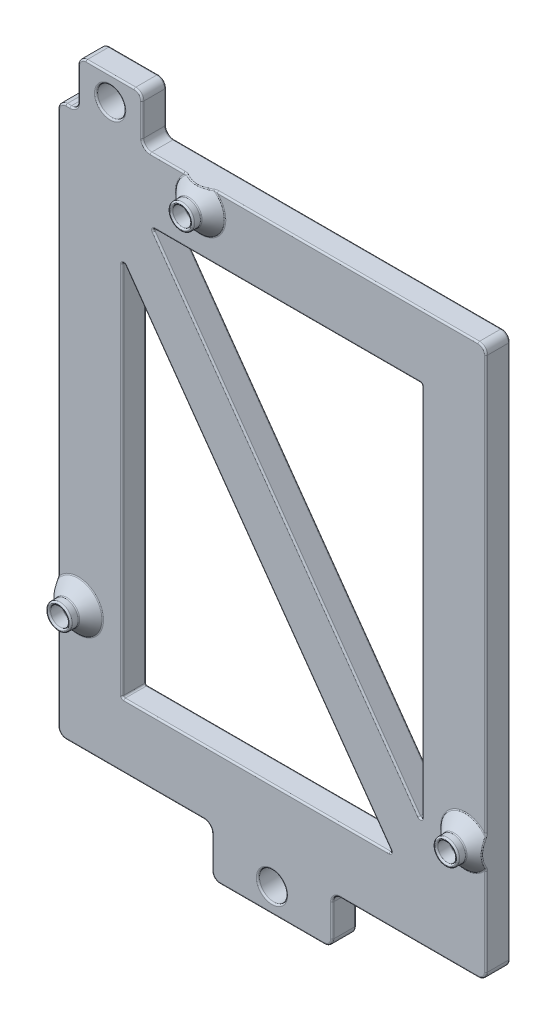
from build123d import *

# Parameters (mm, degrees)
SKIZZE1_R                       = 1.75
SKIZZE1_R_2                     = 1.15
AUFSATZ_LINEAR_AUSTRAGEN1_DEPTH = 3
VERRUNDUNG2_R                   = 1
SKIZZE4_R                       = 1.55
SKIZZE4_R_2                     = 1.15
AUFSATZ_LINEAR_AUSTRAGEN3_DEPTH = 2.5
FASE2_SIZE                      = 1.5
SKIZZE6_R                       = 1.85
SCHNITT_LINEAR_AUSTRAGEN3_DEPTH = 3.7
VERRUNDUNG4_R                   = 0.2


# Some blends are built 0.0001 mm under size
with BuildPart() as part:
    # Skizze1 → Aufsatz-Linear austragen1 (new body)
    with BuildSketch(Plane.XY):
        Polygon((0, 0), (19.17, 0), (19.17, -6), (34.17, -6), (34.17, 0), (53.34, 0), (53.34, 68.58), (10.5, 68.58), (10.5, 74.58), (2.5, 74.58), (2.5, 68.58), (0, 68.58), align=None)
        with Locations((6.5, 71.58)):
            Circle(SKIZZE1_R, mode=Mode.SUBTRACT)
        with Locations((26.67, -3)):
            Circle(SKIZZE1_R, mode=Mode.SUBTRACT)
        with Locations((2.54, 15.24)):
            Circle(SKIZZE1_R_2, mode=Mode.SUBTRACT)
        with Locations((50.8, 13.97)):
            Circle(SKIZZE1_R_2, mode=Mode.SUBTRACT)
        with Locations((17.78, 66.04)):
            Circle(SKIZZE1_R_2, mode=Mode.SUBTRACT)
        Polygon((8, 55.398710594), (41.660476485, 8), (8, 8), align=None, mode=Mode.SUBTRACT)
        Polygon((45.34, 13.181289406), (45.34, 60.58), (11.679523515, 60.58), align=None, mode=Mode.SUBTRACT)
    extrude(amount=AUFSATZ_LINEAR_AUSTRAGEN1_DEPTH)

    # Verrundung2
    verrundung2_edges = [part.edges().sort_by_distance(p)[0] for p in [
        (0, 68.58, 1.5),
        (2.5, 68.58, 1.5),
        (2.5, 74.58, 1.5),
        (10.5, 74.58, 1.5),
        (10.5, 68.58, 1.5),
        (53.34, 68.58, 1.5),
        (53.34, 0, 1.5),
        (34.17, 0, 1.5),
        (34.17, -6, 1.5),
        (19.17, -6, 1.5),
        (19.17, 0, 1.5),
        (0, 0, 1.5),
    ]]
    fillet(verrundung2_edges, radius=VERRUNDUNG2_R)

    # Skizze4 → Aufsatz-Linear austragen3 (add)
    # profile 1 of 3: a face of its own
    with BuildSketch(Plane.XY.offset(3)):
        with Locations(Location((2.54, 15.24, 0), (0, 0, 180))):
            Circle(SKIZZE4_R)
        with Locations((2.54, 15.24)):
            Circle(SKIZZE4_R_2, mode=Mode.SUBTRACT)
    # profile 2 of 3: a face of its own
    with BuildSketch(Plane.XY.offset(3)):
        with Locations(Location((50.8, 13.97, 0), (0, 0, 180))):
            Circle(SKIZZE4_R)
        with Locations((50.8, 13.97)):
            Circle(SKIZZE4_R_2, mode=Mode.SUBTRACT)
    # profile 3 of 3: a face of its own
    with BuildSketch(Plane.XY.offset(3)):
        with Locations(Location((17.78, 66.04, 0), (0, 0, 180))):
            Circle(SKIZZE4_R)
        with Locations((17.78, 66.04)):
            Circle(SKIZZE4_R_2, mode=Mode.SUBTRACT)
    extrude(amount=AUFSATZ_LINEAR_AUSTRAGEN3_DEPTH)

    # Fase2
    # the kernel refuses this chamfer: 1.5 mm, written as the material it adds along each edge
    with BuildSketch(Plane(origin=(17.78, 66.04, 3), x_dir=(-1, 0, 0), z_dir=(0, 1, 0))) as fase2_piece_1_section:
        Polygon((1.55 + FASE2_SIZE, 0), (1.55, FASE2_SIZE), (1.55, 0), align=None)
    fase2_piece_1 = revolve(axis=Axis((17.78, 66.04, 3), (0, 0, 1)), mode=Mode.PRIVATE)
    fase2_piece_1 = split(fase2_piece_1, bisect_by=Plane(origin=(20.06233231, 68.58, 3.73233231), z_dir=(0, -1, 0)), keep=Keep.TOP, mode=Mode.PRIVATE)
    add(fase2_piece_1)
    with BuildSketch(Plane(origin=(50.8, 13.97, 3), x_dir=(-1, 0, 0), z_dir=(0, 1, 0))) as fase2_piece_2_section:
        Polygon((1.55 + FASE2_SIZE, 0), (1.55, FASE2_SIZE), (1.55, 0), align=None)
    fase2_piece_2 = revolve(axis=Axis((50.8, 13.97, 3), (0, 0, 1)), mode=Mode.PRIVATE)
    fase2_piece_2 = split(fase2_piece_2, bisect_by=Plane(origin=(53.34, 13.97, 3.732332312), z_dir=(-1, 0, 0)), keep=Keep.TOP, mode=Mode.PRIVATE)
    add(fase2_piece_2)
    with BuildSketch(Plane(origin=(2.54, 15.24, 3), x_dir=(-1, 0, 0), z_dir=(0, 1, 0))) as fase2_piece_3_section:
        Polygon((1.55 + FASE2_SIZE, 0), (1.55, FASE2_SIZE), (1.55, 0), align=None)
    fase2_piece_3 = revolve(axis=Axis((2.54, 15.24, 3), (0, 0, 1)), mode=Mode.PRIVATE)
    fase2_piece_3 = split(fase2_piece_3, bisect_by=Plane(origin=(0, 15.24, 3.73233231), z_dir=(1, 0, 0)), keep=Keep.TOP, mode=Mode.PRIVATE)
    add(fase2_piece_3)

    # Skizze6 → Schnitt-Linear austragen3 (cut)
    with BuildSketch(Plane(origin=(0, 0, 0), x_dir=(-1, 0, 0), z_dir=(0, 0, -1))):
        with Locations((-50.8, 13.97)):
            Circle(SKIZZE6_R)
        with Locations((-17.78, 66.04)):
            Circle(SKIZZE6_R)
        with Locations((-2.54, 15.24)):
            Circle(SKIZZE6_R)
    extrude(amount=-SCHNITT_LINEAR_AUSTRAGEN3_DEPTH, mode=Mode.SUBTRACT)

    # Verrundung4
    verrundung4_edges = [part.edges().sort_by_distance(p)[0] for p in [
        (26.67, -6, 3),
        (34.17, -3, 3),
        (43.755, 0, 3),
        (53.34, 6.640769581, 3),
        (2.5, 71.58, 3),
        (1.25, 68.58, 3),
        (53.047106781, 68.287106781, 3),
        (53.047106781, 0.292893219, 3),
        (33.877106781, -5.707106781, 3),
        (19.462893219, -5.707106781, 3),
        (0.292893219, 0.292893219, 3),
        (0.292893219, 68.287106781, 3),
        (2.792893219, 74.287106781, 3),
        (10.207106781, 74.287106781, 3),
        (10.792893219, 68.872893219, 0),
        (10.792893219, 68.872893219, 3),
        (2.207106781, 68.872893219, 0),
        (2.207106781, 68.872893219, 3),
        (18.877106781, -0.292893219, 0),
        (18.877106781, -0.292893219, 3),
        (34.462893219, -0.292893219, 0),
        (34.462893219, -0.292893219, 3),
        (1.39, 15.24, 5.5),
        (4.09, 15.24, 5.5),
        (49.65, 13.97, 5.5),
        (52.35, 13.97, 5.5),
        (16.63, 66.04, 5.5),
        (19.33, 66.04, 5.5),
        (19.33, 66.04, 4.5),
        (0, 7.275769581, 3),
        (53.34, 41.619230419, 3),
        (13.795769581, 68.58, 3),
        (5.59, 15.24, 3),
        (49.918098645, 16.889717452, 3),
        (19.220953581, 63.351849562, 3),
        (52.35, 13.97, 4.5),
        (4.09, 15.24, 4.5),
        (17.78, 68.58, 3.51),
        (53.34, 13.97, 3.51),
        (0, 16.044798111, 3.385548837),
        (52.65, 13.97, 3.7),
        (49.65, 13.97, 3.7),
        (52.65, 13.97, 0),
        (19.63, 66.04, 3.7),
        (16.63, 66.04, 3.7),
        (19.63, 66.04, 0),
        (4.39, 15.24, 3.7),
        (1.39, 15.24, 3.7),
        (4.39, 15.24, 0),
        (4.75, 71.58, 0),
        (4.75, 71.58, 3),
        (28.509761757, 60.58, 0),
        (45.34, 60.58, 1.5),
        (28.509761757, 36.880644703, 0),
        (11.679523515, 60.58, 1.5),
        (45.34, 36.880644703, 0),
        (45.34, 13.181289406, 1.5),
        (28.509761757, 60.58, 3),
        (28.509761757, 36.880644703, 3),
        (45.34, 36.880644703, 3),
        (8, 31.699355297, 0),
        (8, 55.398710594, 1.5),
        (24.830238243, 8, 0),
        (8, 8, 1.5),
        (24.830238243, 31.699355297, 0),
        (41.660476485, 8, 1.5),
        (8, 31.699355297, 3),
        (24.830238243, 8, 3),
        (24.830238243, 31.699355297, 3),
        (24.92, -3, 0),
        (24.92, -3, 3),
        (10.5, 71.58, 0),
        (10.5, 71.58, 3),
        (31.92, 68.58, 0),
        (35.904230419, 68.58, 3),
        (6.5, 74.58, 0),
        (6.5, 74.58, 3),
        (0, 34.29, 0),
        (1.25, 68.58, 0),
        (2.5, 71.58, 0),
        (53.34, 34.29, 0),
        (43.755, 0, 0),
        (34.17, -3, 0),
        (26.67, -6, 0),
        (19.17, -3, 0),
        (9.585, 0, 0),
        (53.047106781, 68.287106781, 0),
        (53.047106781, 0.292893219, 0),
        (33.877106781, -5.707106781, 0),
        (19.462893219, -5.707106781, 0),
        (0.292893219, 0.292893219, 0),
        (0.292893219, 68.287106781, 0),
        (2.792893219, 74.287106781, 0),
        (10.207106781, 74.287106781, 0),
        (0, 42.254230419, 3),
        (9.585, 0, 3),
        (19.17, -3, 3),
    ]]
    fillet(verrundung4_edges, radius=VERRUNDUNG4_R - 0.0001)  # a hair under: the kernel refuses the full size


solid = part.part
